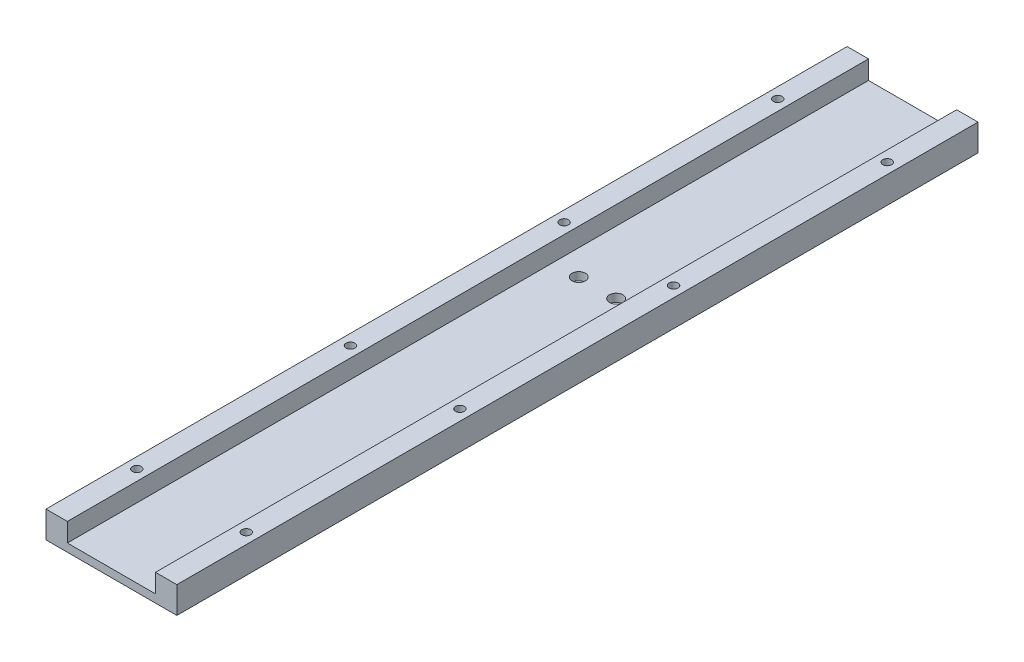
from build123d import *

# Parameters (mm, degrees)
BOSS_EXTRU_1_DEPTH           = 300
ENL_V_MAT_EXTRU_1_DEPTH      = 305.05591591
ENL_V_MAT_EXTRU_1_DEPTH_BACK = 305.05591591
ESQUISSE2_R                  = 2.5
ENL_V_MAT_EXTRU_2_DEPTH      = 305.1397705
ENL_V_MAT_EXTRU_2_DEPTH_BACK = 305.1397705
ESQUISSE3_R                  = 1.65


with BuildPart() as part:
    # Esquisse1 → Boss.-Extru.1 (new body)
    with BuildSketch(Plane.XY):
        Polygon((0, 0), (0, 10), (8, 10), (8, 3), (41, 3), (41, 10), (49, 10), (49, 0), align=None)
    extrude(amount=BOSS_EXTRU_1_DEPTH)

    # Esquisse2 → Enlèv. mat.-Extru.1 (cut, two sides: drawn at the far end of the back side and taken through both)
    with BuildSketch(Plane(origin=(0, 3, 0), x_dir=(1, 0, 0), z_dir=(0, 1, 0)).offset(-ENL_V_MAT_EXTRU_1_DEPTH_BACK)):
        with Locations((17.5, -118)):
            Circle(ESQUISSE2_R)
        with Locations((31.5, -118)):
            Circle(ESQUISSE2_R)
    extrude(amount=ENL_V_MAT_EXTRU_1_DEPTH + ENL_V_MAT_EXTRU_1_DEPTH_BACK, mode=Mode.SUBTRACT)

    # Esquisse3 → Enlèv. mat.-Extru.2 (cut, two sides: drawn at the far end of the back side and taken through both)
    with BuildSketch(Plane(origin=(0, 10, 0), x_dir=(1, 0, 0), z_dir=(0, 1, 0)).offset(-ENL_V_MAT_EXTRU_2_DEPTH_BACK)):
        with Locations((45, -270)):
            Circle(ESQUISSE3_R)
        with Locations((45, -190)):
            Circle(ESQUISSE3_R)
        with Locations((45, -110)):
            Circle(ESQUISSE3_R)
        with Locations((45, -30)):
            Circle(ESQUISSE3_R)
        with Locations((4, -30)):
            Circle(ESQUISSE3_R)
        with Locations((4, -110)):
            Circle(ESQUISSE3_R)
        with Locations((4, -190)):
            Circle(ESQUISSE3_R)
        with Locations((4, -270)):
            Circle(ESQUISSE3_R)
    extrude(amount=ENL_V_MAT_EXTRU_2_DEPTH + ENL_V_MAT_EXTRU_2_DEPTH_BACK, mode=Mode.SUBTRACT)


solid = part.part
